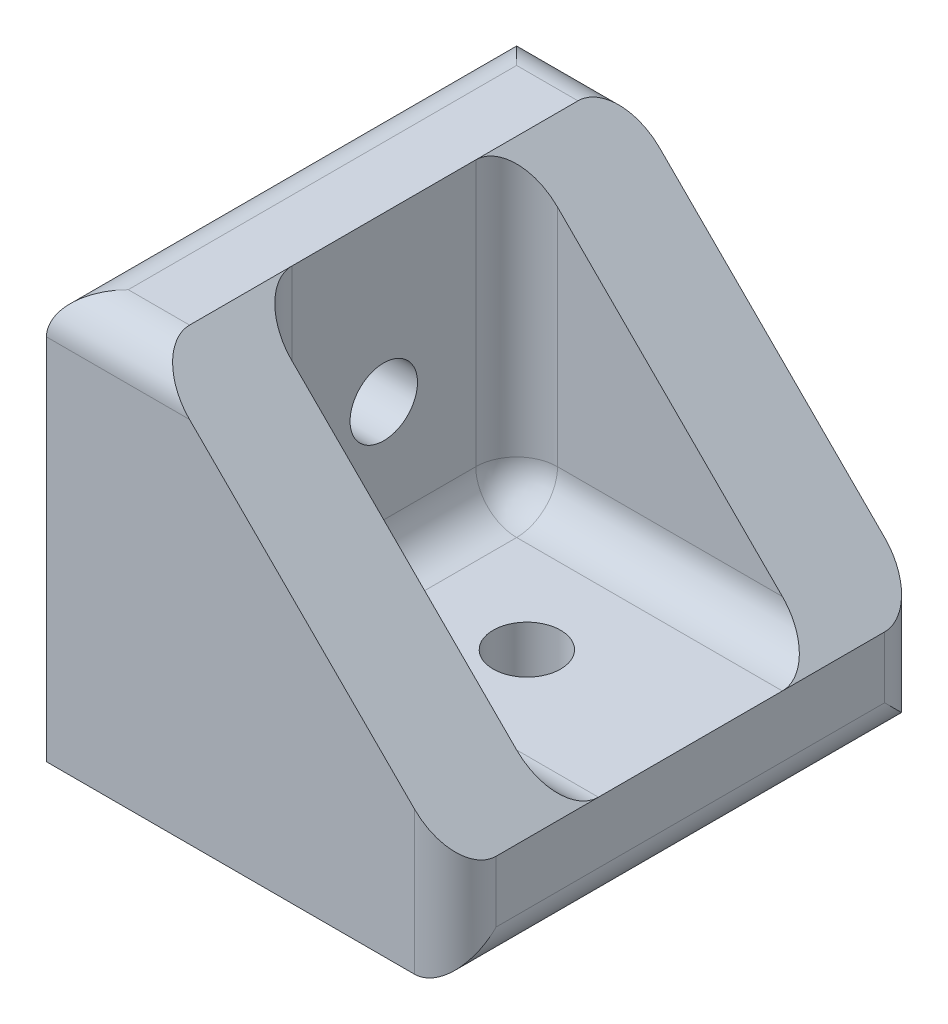
from build123d import *

# Parameters (mm, degrees)
BOSS_EXTRUDE2_DEPTH                   = 23
SHELL1_START                          = 5
SHELL1_OUTLINE_W                      = 16
SHELL1_OUTLINE_H                      = 13
SHELL1_DEPTH                          = 15
FILLET1_R                             = 2
FILLET3_R                             = 2
TAP_DRILL_FOR_M4X0_7_TAP1_D           = 3.3
TAP_DRILL_FOR_M4X0_7_TAP1_ON_FACE_2_D = 3.3


# Read off the part's stored shape, not the designer's step: Shell1
with BuildPart() as part:
    # Sketch1 → Boss-Extrude2 (new body)
    with BuildSketch(Plane.XY):
        Polygon((0, 0), (0, 20), (5, 20), (20, 5), (20, 0), align=None)
    extrude(amount=-BOSS_EXTRUDE2_DEPTH)

    # Shell1 outline → Shell1 (cut)
    with BuildSketch(Plane(origin=(0, 0, 0), x_dir=(1, 0, 0), z_dir=(0, 1, 0)).offset(SHELL1_START)):
        with Locations((13, 11.5)):
            Rectangle(SHELL1_OUTLINE_W, SHELL1_OUTLINE_H)
    extrude(amount=SHELL1_DEPTH, mode=Mode.SUBTRACT)

    # Fillet1
    fillet1_edges = [part.edges().sort_by_distance(p)[0] for p in [
        (12.5, 5, -18),
        (5, 12.5, -18),
        (5, 5, -11.5),
        (12.5, 5, -5),
        (5, 12.5, -5),
    ]]
    fillet(fillet1_edges, radius=FILLET1_R)

    # Fillet3
    fillet3_edges = [part.edges().sort_by_distance(p)[0] for p in [
        (2.5, 20, -23),
        (2.5, 20, 0),
        (20, 2.5, 0),
        (20, 2.5, -23),
        (0, 20, -11.5),
        (20, 0, -11.5),
    ]]
    fillet(fillet3_edges, radius=FILLET3_R)

    # Tap Drill for M4x0.7 Tap1 (through all)
    with Locations(Plane(origin=(5, 12, -11.5), x_dir=(0, 0, 1), z_dir=(1, 0, 0))):
        with Locations((0, 0)):
            Hole(TAP_DRILL_FOR_M4X0_7_TAP1_D / 2)

    # Tap Drill for M4x0.7 Tap1 on face 2 (through all)
    with Locations(Plane(origin=(12, 5, -11.5), x_dir=(0, 0, 1), z_dir=(0, 1, 0))):
        with Locations((0, 0)):
            Hole(TAP_DRILL_FOR_M4X0_7_TAP1_ON_FACE_2_D / 2)


solid = part.part
